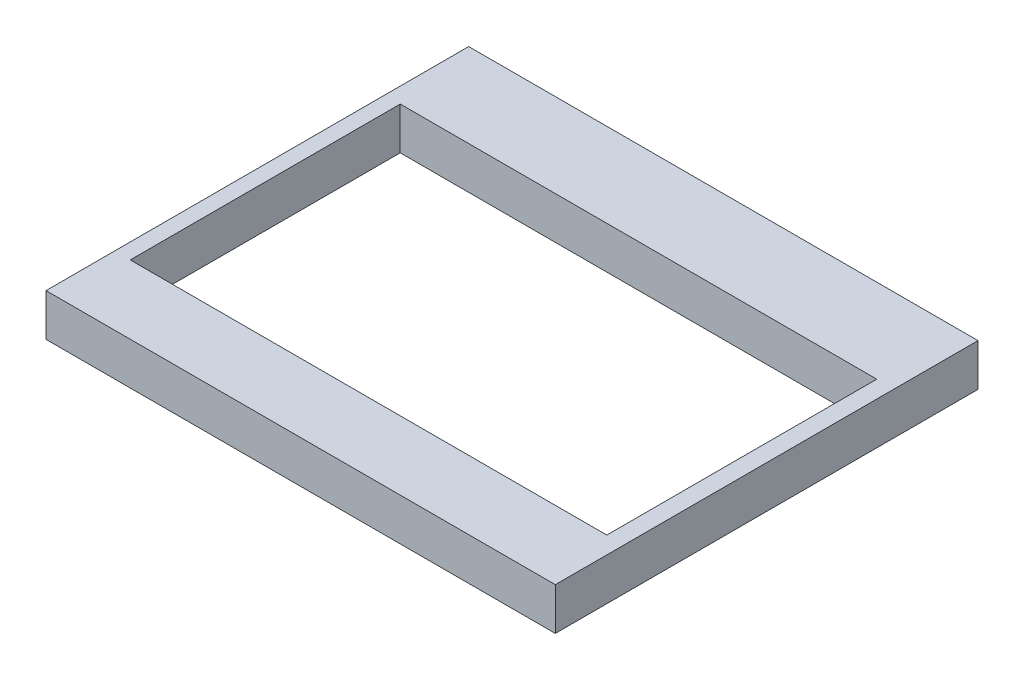
from build123d import *

# Parameters (mm, degrees)
SKETCH1_W           = 306.04968
SKETCH1_H           = 25.4
BOSS_EXTRUDE1_DEPTH = 254
SKETCH2_W           = 286.361272486
SKETCH2_H           = 162.233225726
CUT_EXTRUDE1_DEPTH  = 298.620163391


with BuildPart() as part:
    # Sketch1 → Boss-Extrude1 (new body)
    with BuildSketch(Plane.XY):
        Rectangle(SKETCH1_W, SKETCH1_H)
    extrude(amount=-BOSS_EXTRUDE1_DEPTH)

    # Sketch2 → Cut-Extrude1 (cut, through all)
    with BuildSketch(Plane.XZ.offset(12.7)):
        with Locations((-0.496767733, -122.391612863)):
            Rectangle(SKETCH2_W, SKETCH2_H)
    extrude(amount=-CUT_EXTRUDE1_DEPTH, mode=Mode.SUBTRACT)


solid = part.part
